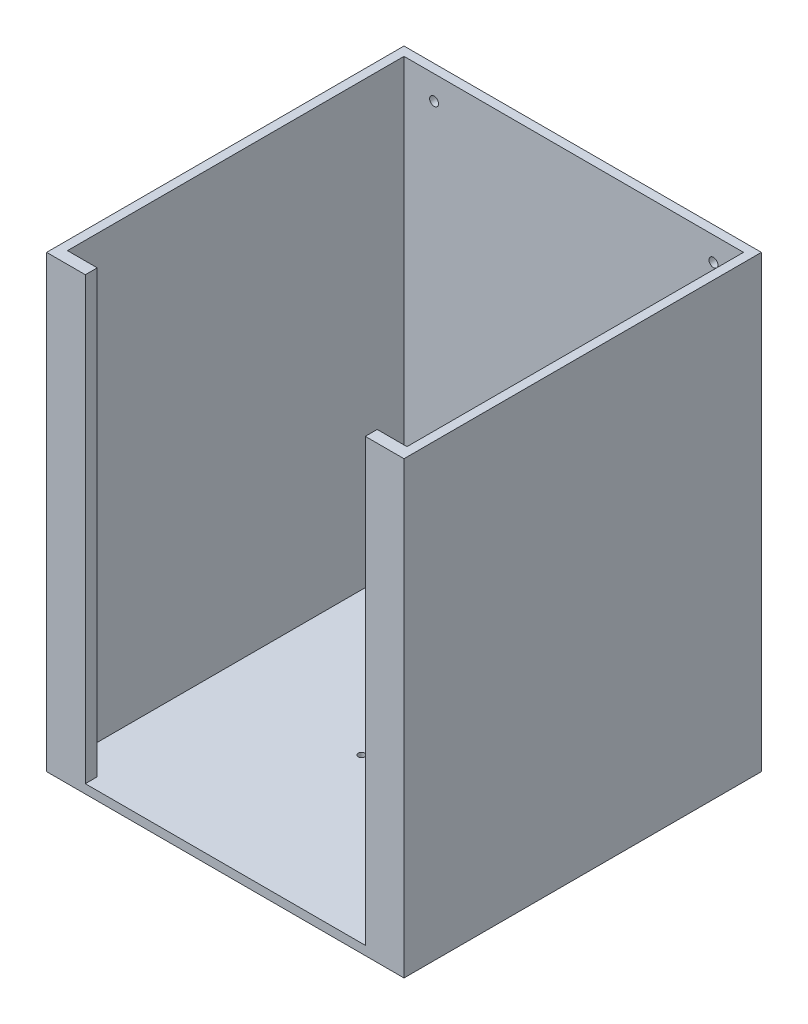
from build123d import *

# Parameters (mm, degrees)
SKETCH1_W                = 120
SKETCH1_H                = 120
MAIN_BODY_DEPTH          = 151
SKETCH11_W               = 114
SKETCH11_H               = 117
HOLLOW_DEPTH             = 148
SKETCH12_W               = 4
SKETCH12_H               = 148
BOSS_EXTRUDE1_DEPTH      = 10
SKETCH13_W               = 4
SKETCH13_H               = 148
BOSS_EXTRUDE2_DEPTH      = 10
LED_MOUNTING_HOLES_REACH = 175.208
SKETCH14_R               = 1.1
SKETCH15_R               = 1.5
LED_POSITION_DEPTH       = 1
BOLT_HOLE_1_REACH        = 203.993
SKETCH16_R               = 1.5
LPATTERN1_COUNT          = 2
LPATTERN1_PITCH          = 93.8
CUT_EXTRUDE5_DEPTH       = 2


with BuildPart() as part:
    # Sketch1 → Main-Body (new body)
    with BuildSketch(Plane(origin=(0, 0, 0), x_dir=(1, 0, 0), z_dir=(0, 1, 0))):
        Rectangle(SKETCH1_W, SKETCH1_H)
    extrude(amount=MAIN_BODY_DEPTH)

    # Sketch11 → Hollow (cut)
    with BuildSketch(Plane(origin=(0, 151, 0), x_dir=(1, 0, 0), z_dir=(0, 1, 0))):
        with Locations((0, -1.5)):
            Rectangle(SKETCH11_W, SKETCH11_H)
    extrude(amount=-HOLLOW_DEPTH, mode=Mode.SUBTRACT)

    # Sketch12 → Boss-Extrude1 (add)
    with BuildSketch(Plane.ZY.offset(-57)):
        with Locations((58, 77)):
            Rectangle(SKETCH12_W, SKETCH12_H)
    extrude(amount=BOSS_EXTRUDE1_DEPTH)

    # Sketch13 → Boss-Extrude2 (add)
    with BuildSketch(Plane(origin=(-57, 0, 0), x_dir=(0, 0, -1), z_dir=(1, 0, 0))):
        with Locations((-58, 77)):
            Rectangle(SKETCH13_W, SKETCH13_H)
    extrude(amount=BOSS_EXTRUDE2_DEPTH)

    # Sketch14 → LED-Mounting-Holes (cut, up to next)
    with BuildSketch(Plane(origin=(0, 0, 0), x_dir=(0, 0, 1), z_dir=(0, -1, 0)), mode=Mode.PRIVATE) as led_mounting_holes_sk1:
        with Locations((-2.225, 9)):
            Circle(SKETCH14_R)
    led_mounting_holes_tool1 = extrude(led_mounting_holes_sk1.sketch, amount=-LED_MOUNTING_HOLES_REACH, mode=Mode.PRIVATE) & part.part
    # Sketch14 → LED-Mounting-Holes (cut, up to next)
    with BuildSketch(Plane(origin=(0, 0, 0), x_dir=(0, 0, 1), z_dir=(0, -1, 0)), mode=Mode.PRIVATE) as led_mounting_holes_sk2:
        with Locations((5.275, 9)):
            Circle(SKETCH14_R)
    led_mounting_holes_tool2 = extrude(led_mounting_holes_sk2.sketch, amount=-LED_MOUNTING_HOLES_REACH, mode=Mode.PRIVATE) & part.part
    # Sketch14 → LED-Mounting-Holes (cut, up to next)
    with BuildSketch(Plane(origin=(0, 0, 0), x_dir=(0, 0, 1), z_dir=(0, -1, 0)), mode=Mode.PRIVATE) as led_mounting_holes_sk3:
        with Locations((5.275, -9)):
            Circle(SKETCH14_R)
    led_mounting_holes_tool3 = extrude(led_mounting_holes_sk3.sketch, amount=-LED_MOUNTING_HOLES_REACH, mode=Mode.PRIVATE) & part.part
    # Sketch14 → LED-Mounting-Holes (cut, up to next)
    with BuildSketch(Plane(origin=(0, 0, 0), x_dir=(0, 0, 1), z_dir=(0, -1, 0)), mode=Mode.PRIVATE) as led_mounting_holes_sk4:
        with Locations((-2.225, -9)):
            Circle(SKETCH14_R)
    led_mounting_holes_tool4 = extrude(led_mounting_holes_sk4.sketch, amount=-LED_MOUNTING_HOLES_REACH, mode=Mode.PRIVATE) & part.part
    add(led_mounting_holes_tool1.solids().sort_by_distance((-9, 0, -2.225))[0], mode=Mode.SUBTRACT)
    add(led_mounting_holes_tool2.solids().sort_by_distance((-9, 0, 5.275))[0], mode=Mode.SUBTRACT)
    add(led_mounting_holes_tool3.solids().sort_by_distance((9, 0, 5.275))[0], mode=Mode.SUBTRACT)
    add(led_mounting_holes_tool4.solids().sort_by_distance((9, 0, -2.225))[0], mode=Mode.SUBTRACT)

    # Sketch15 → LED-Position (cut)
    with BuildSketch(Plane(origin=(0, 3, 0), x_dir=(1, 0, 0), z_dir=(0, 1, 0))):
        with Locations((0, -0.05)):
            Circle(SKETCH15_R)
    extrude(amount=-LED_POSITION_DEPTH, mode=Mode.SUBTRACT)

    # Sketch16 → Bolt-Hole-1 (cut, up to next)
    with BuildSketch(Plane(origin=(0, 0, -60), x_dir=(-1, 0, 0), z_dir=(0, 0, -1)), mode=Mode.PRIVATE) as bolt_hole_1_sk1:
        with Locations((-46.9, 143)):
            Circle(SKETCH16_R)
    bolt_hole_1_tool1 = extrude(bolt_hole_1_sk1.sketch, amount=-BOLT_HOLE_1_REACH, mode=Mode.PRIVATE) & part.part
    bolt_hole_1 = bolt_hole_1_tool1.solids().sort_by_distance((46.9, 143, -60))[0]
    add(bolt_hole_1, mode=Mode.SUBTRACT)

    # LPattern1: Bolt-Hole-1 ×2
    with Locations(*[(-i * LPATTERN1_PITCH, 0, 0) for i in range(1, LPATTERN1_COUNT)]):
        add(bolt_hole_1, mode=Mode.SUBTRACT)

    # Sketch18 → Cut-Extrude5 (cut)
    with BuildSketch(Plane(origin=(0, 0, 56), x_dir=(-1, 0, 0), z_dir=(0, 0, -1))):
        Polygon((55.2, 136), (53.6, 138.771281292), (50.4, 138.771281292), (48.8, 136), (50.4, 133.228718708), (53.6, 133.228718708), align=None)
    extrude(amount=-CUT_EXTRUDE5_DEPTH, mode=Mode.SUBTRACT)


solid = part.part
